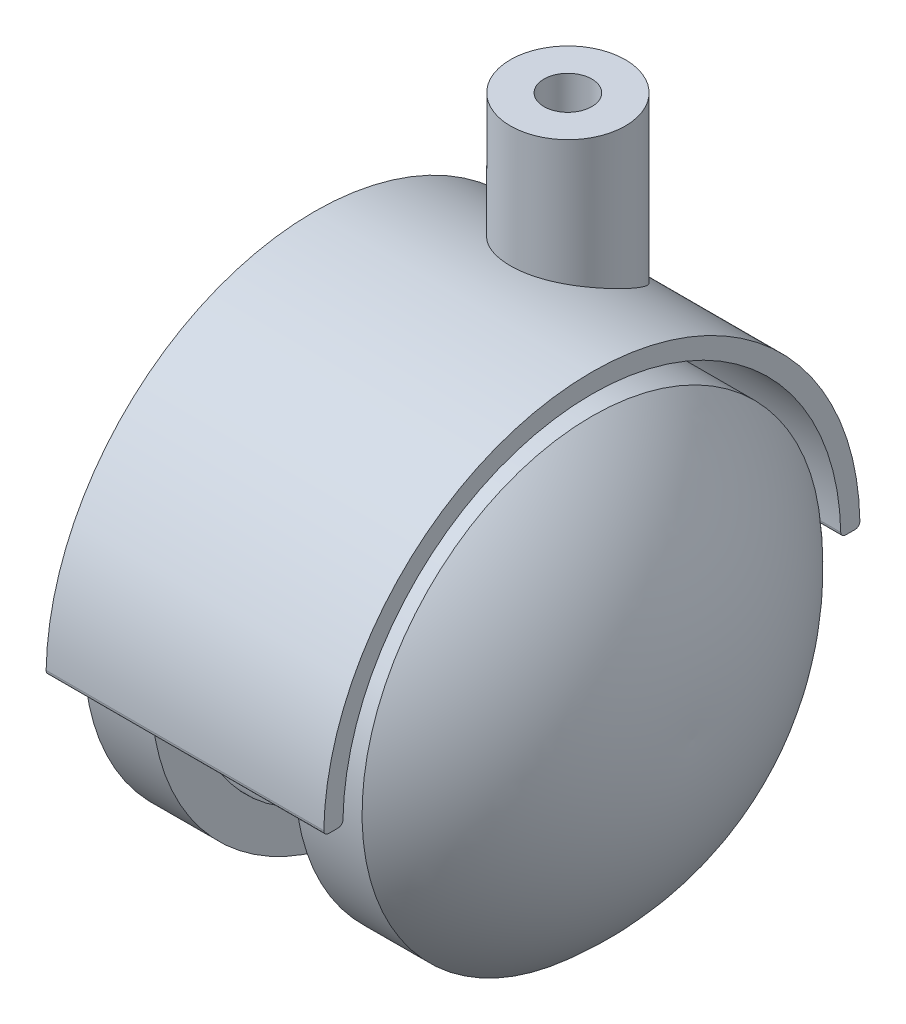
from build123d import *

# Parameters (mm, degrees)
SKETCH1_R           = 24
BOSS_EXTRUDE1_DEPTH = 7
SKETCH4_R           = 20
SKETCH4_R_2         = 7.5
CUT_EXTRUDE1_DEPTH  = 7
SKETCH5_R           = 5
BOSS_EXTRUDE2_DEPTH = 7.5
BOSS_EXTRUDE3_DEPTH = 29
SKETCH8_R           = 6
SKETCH8_R_2         = 2.5
BOSS_EXTRUDE4_DEPTH = 40
SKETCH9_W           = 25
SKETCH9_H           = 18
BOSS_EXTRUDE5_DEPTH = 30
FILLET1_START       = 20.499999405
FILLET1_DEPTH       = 9.500000595
FILLET1_2_DEPTH     = 8.500000571
FILLET1_START_2     = 8.500000571
FILLET1_3_DEPTH     = 11.999998834
FILLET1_START_3     = -3
FILLET1_4_DEPTH     = 9
FILLET2_R           = 10


with BuildPart() as part:
    # Sketch1 → Boss-Extrude1 (new body)
    with BuildSketch(Plane(origin=(0, 0, 0), x_dir=(0, 0, -1), z_dir=(1, 0, 0))):
        Circle(SKETCH1_R)
    boss_extrude1 = extrude(amount=BOSS_EXTRUDE1_DEPTH)

    # Sketch3 → Revolve1 (revolve)
    with BuildSketch(Plane.XY):
        with BuildLine():
            Line((0, 0), (0, 24))
            ThreePointArc((0, 24), (-8.008017152, 13.206632504), (-10.5, 0))
            Line((-10.5, 0), (0, 0))
        make_face()
    revolve1 = revolve(axis=Axis((0, 0, 0), (-1, 0, 0)))

    # Sketch4 → Cut-Extrude1 (cut)
    with BuildSketch(Plane(origin=(7, 0, 0), x_dir=(0, 0, -1), z_dir=(1, 0, 0))):
        Circle(SKETCH4_R)
        Circle(SKETCH4_R_2, mode=Mode.SUBTRACT)
    cut_extrude1 = extrude(amount=-CUT_EXTRUDE1_DEPTH, mode=Mode.SUBTRACT)

    # Sketch5 → Boss-Extrude2 (add)
    with BuildSketch(Plane(origin=(7, 0, 0), x_dir=(0, 0, -1), z_dir=(1, 0, 0))):
        Circle(SKETCH5_R)
    boss_extrude2 = extrude(amount=BOSS_EXTRUDE2_DEPTH)

    # Mirror8: Boss-Extrude2 across plane
    add(boss_extrude2.mirror(Plane(origin=(14.5, 0, 0), x_dir=(0, 0, 1), z_dir=(1, 0, 0))))

    # Mirror9: Boss-Extrude1 across plane
    add(boss_extrude1.mirror(Plane(origin=(14.5, 0, 0), x_dir=(0, 0, 1), z_dir=(1, 0, 0))))

    # Mirror10: Revolve1 across plane
    add(revolve1.mirror(Plane(origin=(14.5, 0, 0), x_dir=(0, 0, 1), z_dir=(1, 0, 0))))

    # Mirror11: Cut-Extrude1 across plane
    add(cut_extrude1.mirror(Plane(origin=(14.5, 0, 0), x_dir=(0, 0, 1), z_dir=(1, 0, 0))), mode=Mode.SUBTRACT)


with BuildPart() as body_2:
    # Sketch6 → Boss-Extrude3 (new body)
    with BuildSketch(Plane(origin=(0, 0, 0), x_dir=(0, 0, -1), z_dir=(1, 0, 0))):
        with BuildLine():
            Line((-26.495282599, 0), (-27.49545417, 0))
            ThreePointArc((-27.49545417, 0), (-27.852207204, 0.149675475), (-27.995371518, 0.509090909))
            ThreePointArc((-27.995371518, 0.509090909), (0, 28), (27.995371518, 0.509090909))
            ThreePointArc((27.995371518, 0.509090909), (27.852207204, 0.149675475), (27.49545417, 0))
            Line((27.49545417, 0), (26.495282599, 0))
            ThreePointArc((26.495282599, 0), (26.145080501, 0.143126786), (25.995371607, 0.490566038))
            ThreePointArc((25.995371607, 0.490566038), (0, 26), (-25.995371607, 0.490566038))
            ThreePointArc((-25.995371607, 0.490566038), (-26.145080501, 0.143126786), (-26.495282599, 0))
        make_face()
    extrude(amount=BOSS_EXTRUDE3_DEPTH)

    # Sketch8 → Boss-Extrude4 (add)
    with BuildSketch(Plane(origin=(0, 0, 0), x_dir=(1, 0, 0), z_dir=(0, 1, 0))):
        with Locations(Location((14.5, 12, 0), (0, 0, 90))):
            Circle(SKETCH8_R)
        with Locations(Location((14.5, 12, 0), (0, 0, 90))):
            Circle(SKETCH8_R_2, mode=Mode.SUBTRACT)
    extrude(amount=BOSS_EXTRUDE4_DEPTH)

    # Sketch9 → Boss-Extrude5 (add)
    with BuildSketch(Plane(origin=(0, 0, 0), x_dir=(0, 0, -1), z_dir=(1, 0, 0))):
        with Locations((6, -3)):
            Rectangle(SKETCH9_W, SKETCH9_H)
    extrude(amount=BOSS_EXTRUDE5_DEPTH)

    # Fillet1: read off the stored shape, not the designer's step
    # Fillet1 outline → Fillet1 (cut)
    with BuildSketch(Plane.YZ.offset(FILLET1_START)):
        with BuildLine():
            ThreePointArc((6, -8.5), (3.416198487, -15.208203932), (-3, -18.449874371))
            ThreePointArc((-3, -18.449874371), (-9.416198487, -15.208203932), (-12, -8.5))
            Line((-12, -8.5), (-12, -18.5))
            Line((-12, -18.5), (6, -18.5))
            Line((6, -18.5), (6, -8.5))
        make_face()
    extrude(amount=FILLET1_DEPTH, mode=Mode.SUBTRACT)

    # Fillet1 2 outline → Fillet1 2 (cut)
    with BuildSketch(Plane.YZ):
        with BuildLine():
            ThreePointArc((6, -8.5), (3.416198487, -15.208203932), (-3, -18.449874371))
            ThreePointArc((-3, -18.449874371), (-9.416198487, -15.208203932), (-12, -8.5))
            Line((-12, -8.5), (-12, -18.5))
            Line((-12, -18.5), (6, -18.5))
            Line((6, -18.5), (6, -8.5))
        make_face()
    extrude(amount=FILLET1_2_DEPTH, mode=Mode.SUBTRACT)

    # Fillet1 3 outline → Fillet1 3 (cut)
    with BuildSketch(Plane.YZ.offset(FILLET1_START_2)):
        with BuildLine():
            ThreePointArc((6, -8.5), (3.416198487, -15.208203932), (-3, -18.449874371))
            ThreePointArc((-3, -18.449874371), (-9.416198487, -15.208203932), (-12, -8.5))
            Line((-12, -8.5), (-12, -18.5))
            Line((-12, -18.5), (6, -18.5))
            Line((6, -18.5), (6, -8.5))
        make_face()
    extrude(amount=FILLET1_3_DEPTH, mode=Mode.SUBTRACT)

    # Fillet1 4 outline → Fillet1 4 (add)
    with BuildSketch(Plane(origin=(0, 0, 0), x_dir=(1, 0, 0), z_dir=(0, 1, 0)).offset(FILLET1_START_3)):
        with BuildLine():
            ThreePointArc((17.81662479, 7), (14.5, 18), (11.18337521, 7))
            Line((11.18337521, 7), (17.81662479, 7))
        make_face()
    extrude(amount=FILLET1_4_DEPTH)

    # Fillet2
    fillet2_edges = [body_2.edges().sort_by_distance(p)[0] for p in [
        (15, -12, 6.5),
    ]]
    fillet(fillet2_edges, radius=FILLET2_R)


solid = Compound([part.part, body_2.part])
